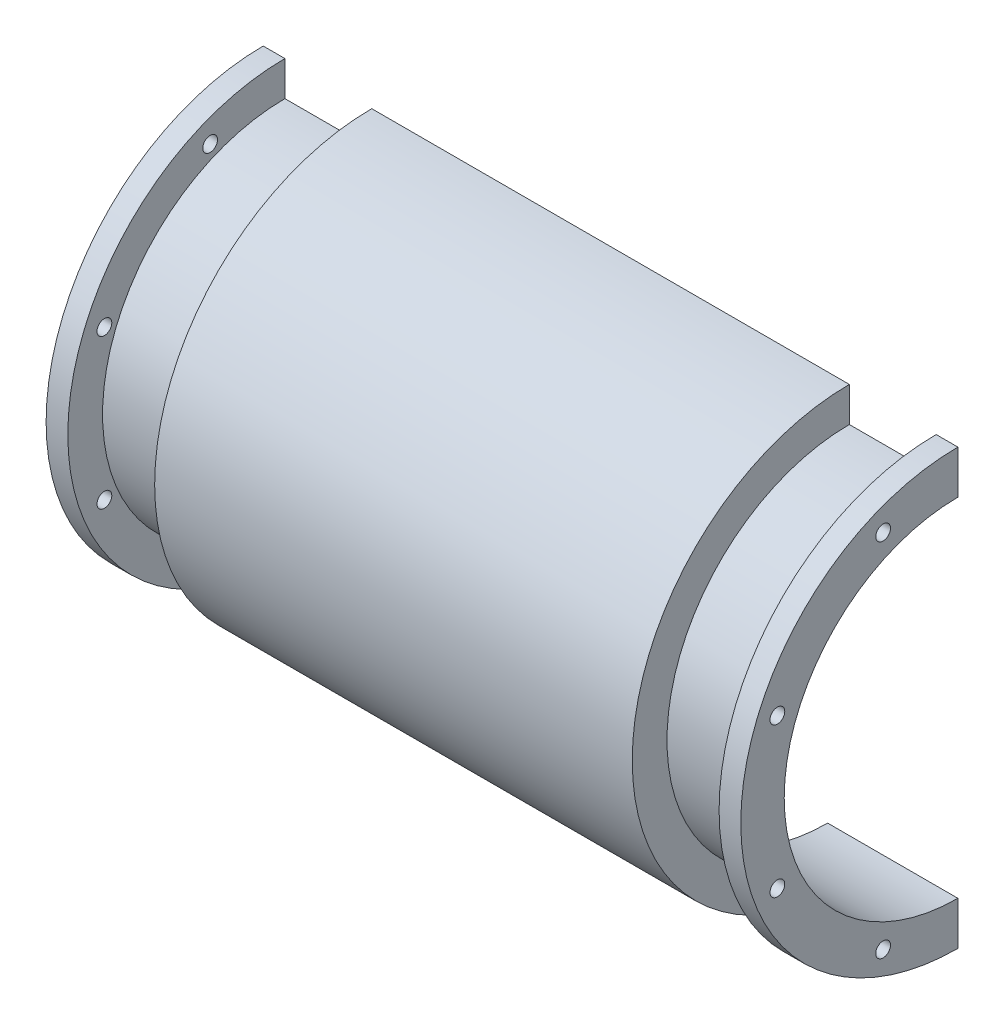
from build123d import *

# Parameters (mm, degrees)
REVOLVE_1_ANGLE          = 180
HOLE_WIZARD_M3_1_D       = 3.4
HOLE_WIZARD_M3_1_DEPTH   = 5
PATTERN_CIRCULAR_1_COUNT = 4
PATTERN_CIRCULAR_1_ANGLE = 135
MIRROR_1_COPY_1_D        = 3.4
MIRROR_1_COPY_1_DEPTH    = 5
MIRROR_1_COPY_2_D        = 3.4
MIRROR_1_COPY_2_DEPTH    = 5
MIRROR_1_COPY_3_D        = 3.4
MIRROR_1_COPY_3_DEPTH    = 5
FILLET_1_R               = 9


with BuildPart() as part:
    # ｽｹｯﾁ1 → 回転1 (revolve)
    with BuildSketch(Plane.XY):
        Polygon((-80, 40), (-50, 40), (-50, 49), (50, 49), (50, 40), (80, 40), (80, 50), (75, 50), (75, 42), (55, 42), (55, 50), (-55, 50), (-55, 42), (-75, 42), (-75, 50), (-80, 50), align=None)
    revolve(axis=Axis((-50, 0, 0), (1, 0, 0)), revolution_arc=REVOLVE_1_ANGLE)

    # M3 すきま穴1
    with Locations(Plane.ZY.offset(80)):
        with Locations((17.220754456, -41.574578963)):
            hole_wizard_m3_1 = Hole(HOLE_WIZARD_M3_1_D / 2, depth=HOLE_WIZARD_M3_1_DEPTH)

    # 円形ﾊﾟﾀｰﾝ1: M3 すきま穴1 ×4 about axis
    pattern_circular_1_axis = Axis((0, 0, 0), (-1, 0, 0))
    for i in range(1, PATTERN_CIRCULAR_1_COUNT):
        add(hole_wizard_m3_1.rotate(pattern_circular_1_axis, i * PATTERN_CIRCULAR_1_ANGLE / (PATTERN_CIRCULAR_1_COUNT - 1)), mode=Mode.SUBTRACT)

    # ﾐﾗｰ1: M3 すきま穴1 across plane
    add(hole_wizard_m3_1.mirror(Plane(origin=(0, 0, 0), x_dir=(0, 0, 1), z_dir=(1, 0, 0))), mode=Mode.SUBTRACT)

    # ﾐﾗｰ1 copy 1
    with Locations(Plane(origin=(80, 0, 0), x_dir=(0, 0.7071067811865487, 0.7071067811865464), z_dir=(1, 0, 0))):
        with Locations((17.220754456, 41.574578963)):
            Hole(MIRROR_1_COPY_1_D / 2, depth=MIRROR_1_COPY_1_DEPTH)

    # ﾐﾗｰ1 copy 2
    with Locations(Plane.YZ.offset(80)):
        with Locations((17.220754456, 41.574578963)):
            Hole(MIRROR_1_COPY_2_D / 2, depth=MIRROR_1_COPY_2_DEPTH)

    # ﾐﾗｰ1 copy 3
    with Locations(Plane(origin=(80, 0, 0), x_dir=(0, 0.7071067811865441, -0.7071067811865509), z_dir=(1, 0, 0))):
        with Locations((17.220754456, 41.574578963)):
            Hole(MIRROR_1_COPY_3_D / 2, depth=MIRROR_1_COPY_3_DEPTH)

    # ﾌｨﾚｯﾄ1
    fillet_1_edges = [part.edges().sort_by_distance(p)[0] for p in [
        (-50, 0, 49),
        (50, 0, 49),
    ]]
    fillet(fillet_1_edges, radius=FILLET_1_R - 0.0001)  # a hair under: the kernel refuses the full size


solid = part.part
